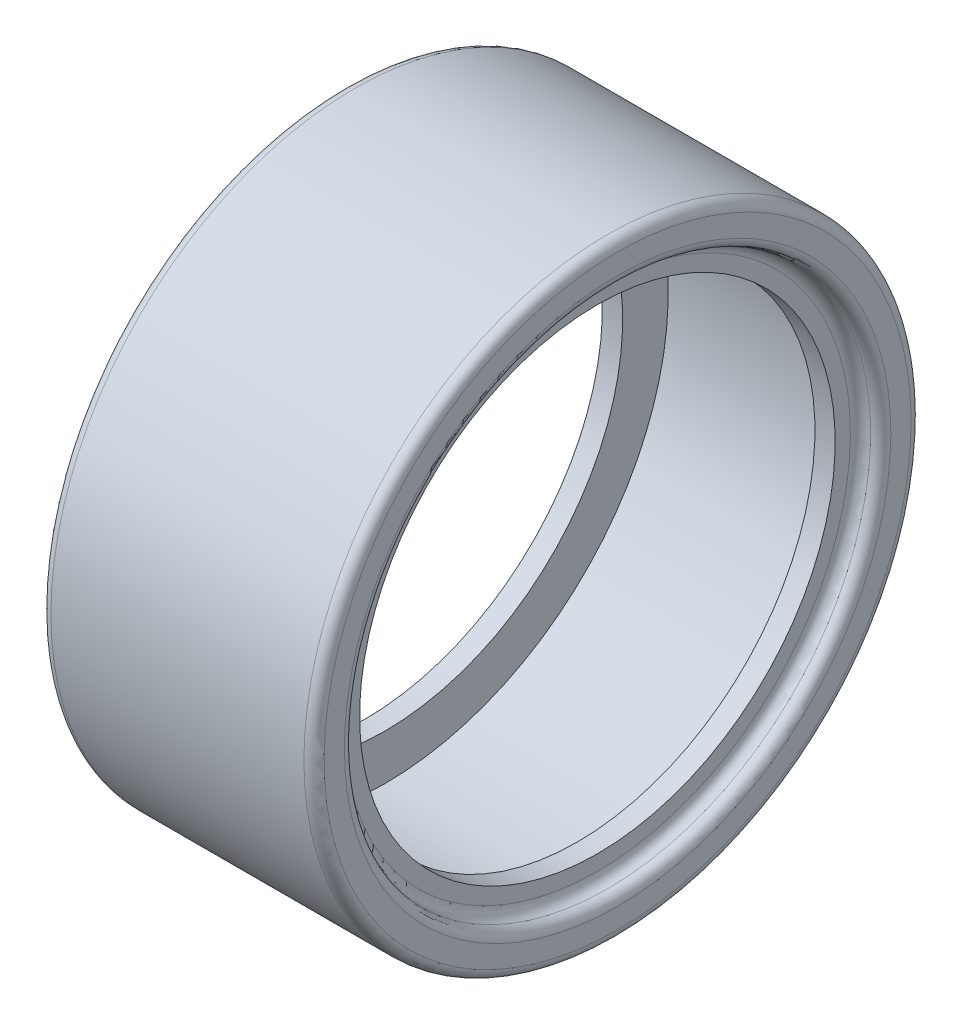
from build123d import *

# Parameters (mm, degrees)
SHELL1_START       = -9.5
SHELL1_OUTLINE_R   = 28
SHELL1_OUTLINE_R_2 = 23.5
SHELL1_DEPTH       = 19
FILLET1_R          = 1


# Read off the part's stored shape, not the designer's step: Shell1
with BuildPart() as part:
    # Sketch1 → Revolve1 (revolve)
    with BuildSketch(Plane.XY, mode=Mode.PRIVATE) as revolve1_sk:
        Polygon((-11.5, 23.5), (-11.5, 26), (-13.5, 26), (-13.5, 30), (13.5, 30), (13.5, 26), (11.5, 26), (11.5, 23.5), align=None)
    revolve(revolve1_sk.sketch.rotate(Axis((-11.5, 0, 0), (1, 0, 0)), 180), axis=Axis((-11.5, 0, 0), (1, 0, 0)))

    # Shell1 outline → Shell1 (cut)
    with BuildSketch(Plane.YZ.offset(SHELL1_START)):
        Circle(SHELL1_OUTLINE_R)
        Circle(SHELL1_OUTLINE_R_2, mode=Mode.SUBTRACT)
    extrude(amount=SHELL1_DEPTH, mode=Mode.SUBTRACT)

    # Fillet1
    fillet1_edges = [part.edges().sort_by_distance(p)[0] for p in [
        (11.5, 26, 0),
        (13.5, 26, 0),
        (13.5, 30, 0),
        (-13.5, 30, 0),
        (-13.5, 26, 0),
        (-11.5, 26, 0),
    ]]
    fillet(fillet1_edges, radius=FILLET1_R - 0.0001)  # a hair under: the kernel refuses the full size


solid = part.part
